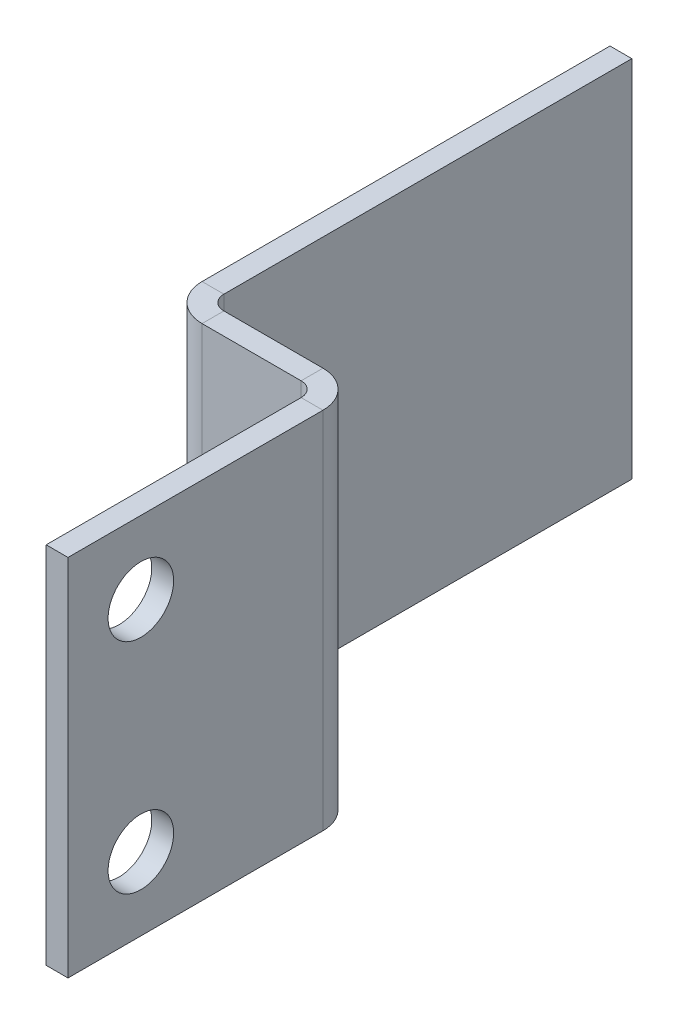
from build123d import *

# Parameters (mm, degrees)
SM_BASE_FLANGE_1_DEPTH = 12.5
HOLE_WIZARD_M4_1_D     = 4.5


# Sheet-metal steps are written as plain solids
with BuildPart() as part:
    # Sketch 1 → 基体-法兰1 (new, symmetric)
    with BuildSketch(Plane(origin=(0, 0, 0), x_dir=(1, 0, 0), z_dir=(0, 1, 0))):
        with BuildLine():
            Line((0, 0), (0, -28))
            ThreePointArc((0, -28), (0.292893219, -28.707106781), (1, -29))
            Line((1, -29), (7.8, -29))
            ThreePointArc((7.8, -29), (9.567766953, -29.732233047), (10.3, -31.5))
            Line((10.3, -31.5), (10.3, -49))
            Line((10.3, -49), (8.8, -49))
            Line((8.8, -49), (8.8, -31.5))
            ThreePointArc((8.8, -31.5), (8.507106781, -30.792893219), (7.8, -30.5))
            Line((7.8, -30.5), (1, -30.5))
            ThreePointArc((1, -30.5), (-0.767766953, -29.767766953), (-1.5, -28))
            Line((-1.5, -28), (-1.5, 0))
            Line((-1.5, 0), (0, 0))
        make_face()
    extrude(amount=SM_BASE_FLANGE_1_DEPTH, both=True)

    # M4 间隙孔1 (through all)
    with Locations(Plane.ZY.offset(-8.8)):
        with Locations((44, 7.5), (44, -7.5)):
            Hole(HOLE_WIZARD_M4_1_D / 2)


solid = part.part
